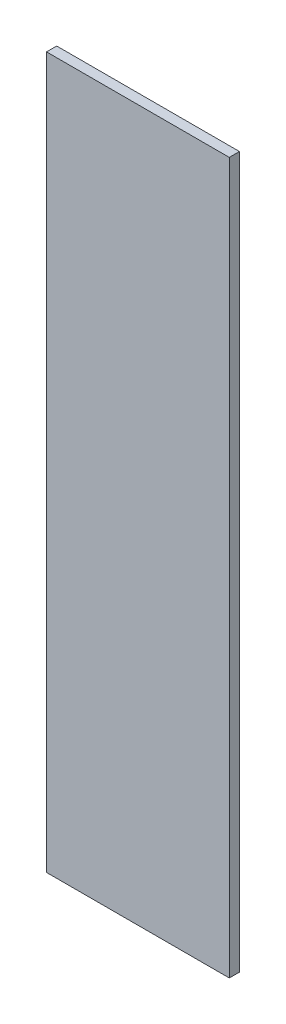
from build123d import *

# Parameters (mm, degrees)
SKETCH1_W          = 90
SKETCH1_H          = 350
BASE_FLANGE1_DEPTH = 5


# Sheet-metal steps are written as plain solids
with BuildPart() as part:
    # Sketch1 → Base-Flange1 (new body)
    with BuildSketch(Plane.XY):
        Rectangle(SKETCH1_W, SKETCH1_H)
    extrude(amount=-BASE_FLANGE1_DEPTH)


solid = part.part
